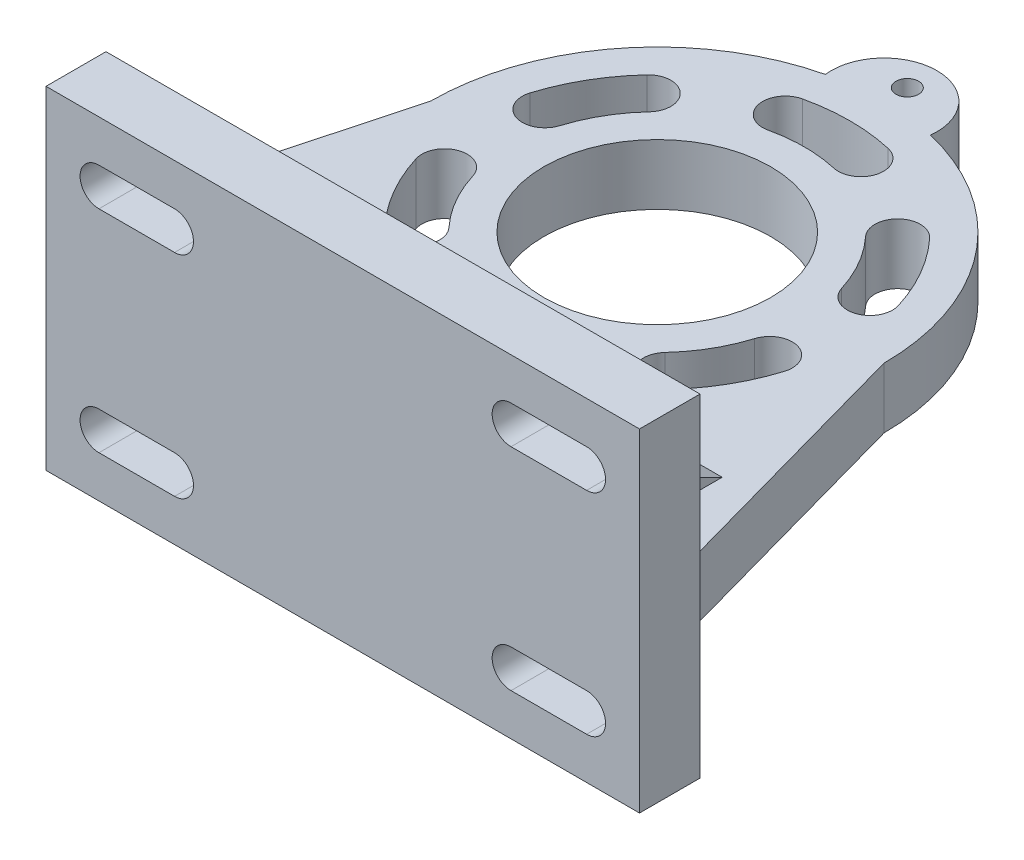
from build123d import *

# Parameters (mm, degrees)
SKETCH1_R                = 30
BOSS_EXTRUDE1_DEPTH      = 8
SKETCH10_R               = 15
CUT_EXTRUDE3_DEPTH       = 10
BOSS_EXTRUDE2_START      = -8
BOSS_EXTRUDE2_DEPTH      = 8
BOSS_EXTRUDE3_DEPTH      = 18
BOSS_EXTRUDE3_DEPTH_BACK = 26
RIB22_REACH              = 86.319
SKETCH15_WALL_W          = 181.819095046
SKETCH15_WALL_H          = 6
MIRROR2_COPY_1_REACH     = 86.319
MIRROR2_COPY_1_SKETCH_W  = 181.819095046
MIRROR2_COPY_1_SKETCH_H  = 6
BOSS_EXTRUDE4_START      = -8
SKETCH16_R               = 1.5
BOSS_EXTRUDE4_DEPTH      = 8
CUT_EXTRUDE4_DEPTH       = 8


with BuildPart() as part:
    # Sketch1 → Boss-Extrude1 (new body)
    with BuildSketch(Plane(origin=(0, 0, 0), x_dir=(1, 0, 0), z_dir=(0, 1, 0))):
        Circle(SKETCH1_R)
    extrude(amount=BOSS_EXTRUDE1_DEPTH)

    # Sketch10 → Cut-Extrude3 (cut)
    with BuildSketch(Plane(origin=(0, 8, 0), x_dir=(1, 0, 0), z_dir=(0, 1, 0))):
        Circle(SKETCH10_R)
        with BuildLine():
            ThreePointArc((5.666666667, 24.862399098), (0, 25.5), (-5.666666667, 24.862399098))
            ThreePointArc((-5.666666667, 24.862399098), (-7.924988129, 21.270744302), (-4.333333333, 19.012422839))
            ThreePointArc((-4.333333333, 19.012422839), (0, 19.5), (4.333333333, 19.012422839))
            ThreePointArc((4.333333333, 19.012422839), (7.924988129, 21.270744302), (5.666666667, 24.862399098))
        make_face()
        with BuildLine():
            ThreePointArc((24.364802551, 7.523722261), (22.083647797, 12.75), (18.698135884, 17.338676837))
            ThreePointArc((18.698135884, 17.338676837), (14.458510858, 17.498613195), (14.2985745, 13.258988169))
            ThreePointArc((14.2985745, 13.258988169), (16.887495374, 9.75), (18.631907833, 5.75343467))
            ThreePointArc((18.631907833, 5.75343467), (22.383498987, 3.772131106), (24.364802551, 7.523722261))
        make_face()
        with BuildLine():
            ThreePointArc((18.698135884, -17.338676837), (22.083647797, -12.75), (24.364802551, -7.523722261))
            ThreePointArc((24.364802551, -7.523722261), (22.383498987, -3.772131106), (18.631907833, -5.75343467))
            ThreePointArc((18.631907833, -5.75343467), (16.887495374, -9.75), (14.2985745, -13.258988169))
            ThreePointArc((14.2985745, -13.258988169), (14.458510858, -17.498613195), (18.698135884, -17.338676837))
        make_face()
        with BuildLine():
            ThreePointArc((-5.666666667, -24.862399098), (0, -25.5), (5.666666667, -24.862399098))
            ThreePointArc((5.666666667, -24.862399098), (7.924988129, -21.270744302), (4.333333333, -19.012422839))
            ThreePointArc((4.333333333, -19.012422839), (0, -19.5), (-4.333333333, -19.012422839))
            ThreePointArc((-4.333333333, -19.012422839), (-7.924988129, -21.270744302), (-5.666666667, -24.862399098))
        make_face()
        with BuildLine():
            ThreePointArc((-24.364802551, -7.523722261), (-22.083647797, -12.75), (-18.698135884, -17.338676837))
            ThreePointArc((-18.698135884, -17.338676837), (-14.458510858, -17.498613195), (-14.2985745, -13.258988169))
            ThreePointArc((-14.2985745, -13.258988169), (-16.887495374, -9.75), (-18.631907833, -5.75343467))
            ThreePointArc((-18.631907833, -5.75343467), (-22.383498987, -3.772131106), (-24.364802551, -7.523722261))
        make_face()
        with BuildLine():
            ThreePointArc((-18.698135884, 17.338676837), (-22.083647797, 12.75), (-24.364802551, 7.523722261))
            ThreePointArc((-24.364802551, 7.523722261), (-22.383498987, 3.772131106), (-18.631907833, 5.75343467))
            ThreePointArc((-18.631907833, 5.75343467), (-16.887495374, 9.75), (-14.2985745, 13.258988169))
            ThreePointArc((-14.2985745, 13.258988169), (-14.458510858, 17.498613195), (-18.698135884, 17.338676837))
        make_face()
    extrude(amount=-CUT_EXTRUDE3_DEPTH, mode=Mode.SUBTRACT)

    # Sketch12 → Boss-Extrude2 (add)
    with BuildSketch(Plane(origin=(0, 8, 0), x_dir=(1, 0, 0), z_dir=(0, 1, 0)).offset(BOSS_EXTRUDE2_START)):
        with BuildLine():
            ThreePointArc((30, 0), (0, -30), (-30, 0))
            Line((-30, 0), (-39.132149187, -33.787628671))
            Line((-39.132149187, -33.787628671), (39.373960889, -33.721341273))
            Line((39.373960889, -33.721341273), (30, 0))
        make_face()
    extrude(amount=BOSS_EXTRUDE2_DEPTH)

    # Sketch13 → Boss-Extrude3 (add, two sides: drawn at the far end of the back side and taken through both)
    with BuildSketch(Plane(origin=(0, 8, 0), x_dir=(1, 0, 0), z_dir=(0, 1, 0)).offset(-BOSS_EXTRUDE3_DEPTH_BACK)):
        Polygon((-39.132149187, -33.787628671), (39.373960889, -33.721341273), (39.373960889, -41.721341273), (-39.132149187, -41.721341273), align=None)
    extrude(amount=BOSS_EXTRUDE3_DEPTH + BOSS_EXTRUDE3_DEPTH_BACK)

    # Sketch15 wall → Rib22 (add, up to next)
    with BuildSketch(Plane(origin=(-29.132149187, 10.5, 28.787628671), x_dir=(0, 0.4472135955, 0.894427191), z_dir=(0, 0.894427191, -0.4472135955)), mode=Mode.PRIVATE) as rib22_sk1:
        Rectangle(SKETCH15_WALL_W, SKETCH15_WALL_H)
    rib22_tool1 = extrude(rib22_sk1.sketch, amount=-RIB22_REACH, mode=Mode.PRIVATE) - part.part
    rib22 = rib22_tool1.solids().sort_by_distance((-29.132149187, 10.5, 28.787628671))[0]
    add(rib22)

    # Mirror1: Rib22 across plane
    add(rib22.mirror(Plane.ZY.offset(-0.120905851)))

    # Mirror2: Rib22 across plane
    add(rib22.mirror(Plane.ZX.offset(4)))

    # Mirror2 copy 1 sketch → Mirror2 copy 1 (add, up to next)
    with BuildSketch(Plane(origin=(29.37396089, -2.5, 28.787628671), x_dir=(0, -0.4472135955, 0.894427191), z_dir=(0, -0.894427191, -0.4472135955)), mode=Mode.PRIVATE) as mirror2_copy_1_sk1:
        Rectangle(MIRROR2_COPY_1_SKETCH_W, MIRROR2_COPY_1_SKETCH_H)
    mirror2_copy_1_tool1 = extrude(mirror2_copy_1_sk1.sketch, amount=-MIRROR2_COPY_1_REACH, mode=Mode.PRIVATE) - part.part
    add(mirror2_copy_1_tool1.solids().sort_by_distance((29.37396089, -2.5, 28.787628671))[0])

    # Sketch16 → Boss-Extrude4 (add)
    with BuildSketch(Plane(origin=(0, 8, 0), x_dir=(1, 0, 0), z_dir=(0, 1, 0)).offset(BOSS_EXTRUDE4_START)):
        with BuildLine():
            ThreePointArc((6.952197894, 29.183333333), (0, 37), (-6.952197894, 29.183333333))
            ThreePointArc((-6.952197894, 29.183333333), (0, 30), (6.952197894, 29.183333333))
        make_face()
        with Locations((0, 33.074498835)):
            Circle(SKETCH16_R, mode=Mode.SUBTRACT)
    extrude(amount=BOSS_EXTRUDE4_DEPTH)

    # Sketch17 → Cut-Extrude4 (cut)
    with BuildSketch(Plane(origin=(0.028500994, 0, 33.754562995), x_dir=(-0.9999996435285086, 0, 0.0008443594353065629), z_dir=(-0.0008443594353065629, 0, -0.9999996435285086))):
        with BuildLine():
            Line((-32.345471426, 20.469812005), (-22.345471426, 20.469812005))
            ThreePointArc((-22.345471426, 20.469812005), (-19.845471426, 17.969812005), (-22.345471426, 15.469812005))
            Line((-22.345471426, 15.469812005), (-32.345471426, 15.469812005))
            ThreePointArc((-32.345471426, 15.469812005), (-34.845471426, 17.969812005), (-32.345471426, 20.469812005))
        make_face()
        with BuildLine():
            Line((32.160661645, 20.469812005), (22.160661645, 20.469812005))
            ThreePointArc((22.160661645, 20.469812005), (19.660661645, 17.969812005), (22.160661645, 15.469812005))
            Line((22.160661645, 15.469812005), (32.160661645, 15.469812005))
            ThreePointArc((32.160661645, 15.469812005), (34.660661645, 17.969812005), (32.160661645, 20.469812005))
        make_face()
        with BuildLine():
            Line((32.160661645, -12.469812005), (22.160661645, -12.469812005))
            ThreePointArc((22.160661645, -12.469812005), (19.660661645, -9.969812005), (22.160661645, -7.469812005))
            Line((22.160661645, -7.469812005), (32.160661645, -7.469812005))
            ThreePointArc((32.160661645, -7.469812005), (34.660661645, -9.969812005), (32.160661645, -12.469812005))
        make_face()
        with BuildLine():
            Line((-32.345471426, -12.469812005), (-22.345471426, -12.469812005))
            ThreePointArc((-22.345471426, -12.469812005), (-19.845471426, -9.969812005), (-22.345471426, -7.469812005))
            Line((-22.345471426, -7.469812005), (-32.345471426, -7.469812005))
            ThreePointArc((-32.345471426, -7.469812005), (-34.845471426, -9.969812005), (-32.345471426, -12.469812005))
        make_face()
    extrude(amount=-CUT_EXTRUDE4_DEPTH, mode=Mode.SUBTRACT)


solid = part.part
